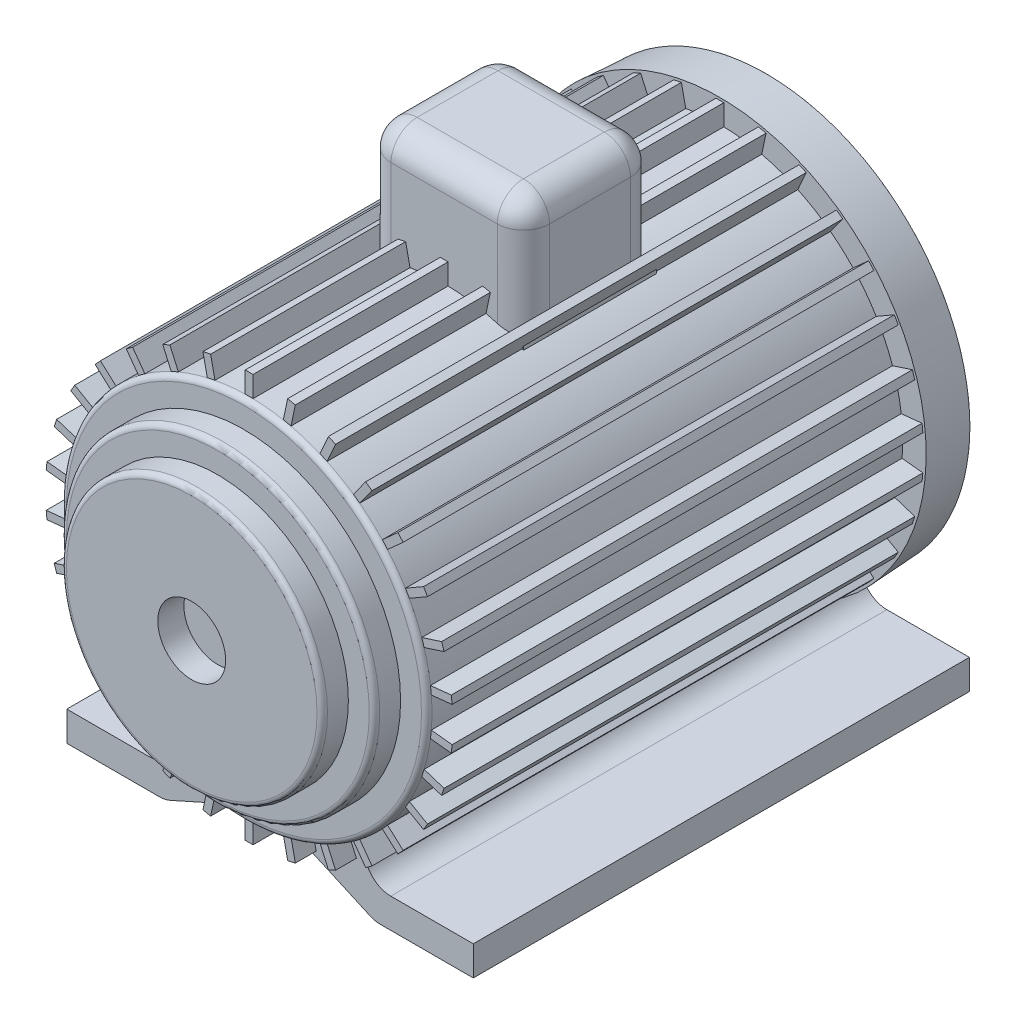
from build123d import *

# Parameters (mm, degrees)
SKETCH1_R           = 70
BOSS_EXTRUDE2_DEPTH = 200
SKETCH2_R           = 60
BOSS_EXTRUDE3_DEPTH = 10
SKETCH3_R           = 50
BOSS_EXTRUDE4_DEPTH = 10
FILLET1_R           = 2
SKETCH4_R           = 13
CUT_EXTRUDE1_DEPTH  = 10
BOSS_EXTRUDE5_DEPTH = 190
FILLET2_R           = 10
BOSS_EXTRUDE6_DEPTH = 1.5
CIRPATTERN1_COUNT   = 30
SKETCH7_W           = 60.710279946
SKETCH7_H           = 50.96617688
BOSS_EXTRUDE7_DEPTH = 110
FILLET3_R           = 10
FILLET4_R           = 10


with BuildPart() as part:
    # Sketch1 → Boss-Extrude2 (new body)
    with BuildSketch(Plane.XY):
        Circle(SKETCH1_R)
    extrude(amount=BOSS_EXTRUDE2_DEPTH)

    # Sketch2 → Boss-Extrude3 (add)
    with BuildSketch(Plane.XY.offset(200)):
        Circle(SKETCH2_R)
    extrude(amount=BOSS_EXTRUDE3_DEPTH)

    # Sketch3 → Boss-Extrude4 (add)
    with BuildSketch(Plane.XY.offset(210)):
        Circle(SKETCH3_R)
    extrude(amount=BOSS_EXTRUDE4_DEPTH)

    # Fillet1
    fillet1_edges = [part.edges().sort_by_distance(p)[0] for p in [
        (-50, 0, 220),
        (-70, 0, 200),
        (-60, 0, 210),
    ]]
    fillet(fillet1_edges, radius=FILLET1_R)

    # Sketch4 → Cut-Extrude1 (cut)
    with BuildSketch(Plane.XY.offset(220)):
        Circle(SKETCH4_R)
    extrude(amount=-CUT_EXTRUDE1_DEPTH, mode=Mode.SUBTRACT)

    # Sketch5 → Boss-Extrude5 (add)
    with BuildSketch(Plane(origin=(0, 0, 0), x_dir=(-1, 0, 0), z_dir=(0, 0, -1))):
        with BuildLine():
            ThreePointArc((0, -70), (-16.73934364, -67.969069248), (-32.507360201, -61.994124986))
            Line((-32.507360201, -61.994124986), (-40.191661565, -76.648699711))
            Line((-40.191661565, -76.648699711), (-77.839251962, -76.648699711))
            Line((-77.839251962, -76.648699711), (-77.839251962, -87.998419038))
            Line((-77.839251962, -87.998419038), (-40.191661565, -87.998419038))
            Line((-40.191661565, -87.998419038), (0, -70))
        make_face()
        with BuildLine():
            ThreePointArc((32.507360201, -61.994124986), (16.73934364, -67.969069248), (0, -70))
            Line((0, -70), (40.191661565, -87.998419038))
            Line((40.191661565, -87.998419038), (77.839251962, -87.998419038))
            Line((77.839251962, -87.998419038), (77.839251962, -76.648699711))
            Line((77.839251962, -76.648699711), (40.191661565, -76.648699711))
            Line((40.191661565, -76.648699711), (32.507360201, -61.994124986))
        make_face()
    extrude(amount=-BOSS_EXTRUDE5_DEPTH)

    # Fillet2
    fillet2_edges = [part.edges().sort_by_distance(p)[0] for p in [
        (40.191661565, -87.998419038, 95),
        (40.191661565, -76.648699711, 95),
        (32.507360201, -61.994124986, 95),
        (0, -70, 95),
        (-40.191661565, -87.998419038, 95),
        (-32.507360201, -61.994124986, 95),
        (-40.191661565, -76.648699711, 95),
    ]]
    fillet(fillet2_edges, radius=FILLET2_R)

    # Sketch6 → Boss-Extrude6 (add, symmetric)
    with BuildSketch(Plane(origin=(0, 0, 0), x_dir=(0, 0, -1), z_dir=(1, 0, 0))):
        Polygon((-198, 70), (-198, 78), (0, 78), (0, 70), (0, 66.154834394), (-198, 66.154834394), align=None)
    boss_extrude6 = extrude(amount=BOSS_EXTRUDE6_DEPTH, both=True)

    # CirPattern1: Boss-Extrude6 ×30 about axis
    cirpattern1_axis = Axis((0, 0, 0), (0, 0, 1))
    for i in range(1, CIRPATTERN1_COUNT):
        add(boss_extrude6.rotate(cirpattern1_axis, i * 360 / CIRPATTERN1_COUNT))

    # Sketch7 → Boss-Extrude7 (add)
    with BuildSketch(Plane(origin=(0, 0, 0), x_dir=(1, 0, 0), z_dir=(0, 1, 0))):
        with Locations((0, -97.820582731)):
            Rectangle(SKETCH7_W, SKETCH7_H)
    extrude(amount=BOSS_EXTRUDE7_DEPTH)

    # Fillet3
    fillet3_edges = [part.edges().sort_by_distance(p)[0] for p in [
        (-30.355139973, 110, 97.820582731),
        (0, 110, 123.303671171),
        (30.355139973, 110, 97.820582731),
        (0, 110, 72.337494291),
    ]]
    fillet(fillet3_edges, radius=FILLET3_R)

    # Fillet4
    # the kernel refuses this fillet: 10 mm, written as the material it takes off along each edge
    with BuildSketch(Plane(origin=(20.355139973, 100, 113.303671171), x_dir=(0, 0, 1), z_dir=(1, 0, 0))) as fillet4_piece_1_section:
        Polygon((0, 0), (FILLET4_R * 1.02, 0), (FILLET4_R * 1.02, -FILLET4_R * 1.02), (0, -FILLET4_R * 1.02), align=None)
    fillet4_piece_1 = extrude(amount=FILLET4_R * 1.02, mode=Mode.PRIVATE)
    fillet4_piece_1 = fillet4_piece_1 - Plane(origin=(20.355139973, 100, 113.303671171), x_dir=(0, -0.7071067811865475, -0.7071067811865475), z_dir=(1, 0, 0)) * Sphere(FILLET4_R, mode=Mode.PRIVATE)
    add(fillet4_piece_1, mode=Mode.SUBTRACT)
    with BuildSketch(Plane(origin=(-20.355139973, 100, 113.303671171), x_dir=(-1, 0, 0), z_dir=(0, 0, 1))) as fillet4_piece_2_section:
        Polygon((0, 0), (FILLET4_R * 1.02, 0), (FILLET4_R * 1.02, -FILLET4_R * 1.02), (0, -FILLET4_R * 1.02), align=None)
    fillet4_piece_2 = extrude(amount=FILLET4_R * 1.02, mode=Mode.PRIVATE)
    fillet4_piece_2 = fillet4_piece_2 - Plane(origin=(-20.355139973, 100, 113.303671171), x_dir=(0.7071067811865475, -0.7071067811865475, 0), z_dir=(0, 0, 1)) * Sphere(FILLET4_R, mode=Mode.PRIVATE)
    add(fillet4_piece_2, mode=Mode.SUBTRACT)
    with BuildSketch(Plane(origin=(-20.355139973, 100, 82.337494291), x_dir=(-1, 0, 0), z_dir=(0, 0, -1))) as fillet4_piece_3_section:
        Polygon((0, 0), (FILLET4_R * 1.02, 0), (FILLET4_R * 1.02, FILLET4_R * 1.02), (0, FILLET4_R * 1.02), align=None)
    fillet4_piece_3 = extrude(amount=FILLET4_R * 1.02, mode=Mode.PRIVATE)
    fillet4_piece_3 = fillet4_piece_3 - Plane(origin=(-20.355139973, 100, 82.337494291), x_dir=(0.7071067811865475, -0.7071067811865475, 0), z_dir=(0, 0, -1)) * Sphere(FILLET4_R, mode=Mode.PRIVATE)
    add(fillet4_piece_3, mode=Mode.SUBTRACT)
    with BuildSketch(Plane(origin=(20.355139973, 100, 82.337494291), x_dir=(0, 0, -1), z_dir=(1, 0, 0))) as fillet4_piece_4_section:
        Polygon((0, 0), (FILLET4_R * 1.02, 0), (FILLET4_R * 1.02, FILLET4_R * 1.02), (0, FILLET4_R * 1.02), align=None)
    fillet4_piece_4 = extrude(amount=FILLET4_R * 1.02, mode=Mode.PRIVATE)
    fillet4_piece_4 = fillet4_piece_4 - Plane(origin=(20.355139973, 100, 82.337494291), x_dir=(0, -0.7071067811865475, 0.7071067811865475), z_dir=(1, 0, 0)) * Sphere(FILLET4_R, mode=Mode.PRIVATE)
    add(fillet4_piece_4, mode=Mode.SUBTRACT)
    with BuildSketch(Plane(origin=(30.355139973, 46.866650661, 123.303671171), x_dir=(0, 0, -1), z_dir=(0, 1, 0))) as fillet4_piece_5_section:
        with BuildLine():
            CenterArc((FILLET4_R, FILLET4_R), FILLET4_R, 180, 90)
            Line((0, FILLET4_R), (0, 0))
            Line((0, 0), (FILLET4_R, 0))
        make_face()
    fillet4_piece_5 = extrude(amount=53.133349339, mode=Mode.PRIVATE)
    fillet4_piece_5 = split(fillet4_piece_5, bisect_by=Plane(origin=(29.066991609, 68.973422063, 121.811746024), z_dir=(-0.913545457642601, 0.40673664307580015, 0)), keep=Keep.TOP, mode=Mode.PRIVATE)
    fillet4_piece_5 = fillet4_piece_5 - Plane(origin=(0, 0, 121.811746024), x_dir=(1, 0, 0), z_dir=(0, 0, -1)) * Cylinder(70, 147, mode=Mode.PRIVATE)
    add(fillet4_piece_5, mode=Mode.SUBTRACT)
    with BuildSketch(Plane(origin=(-30.355139973, 46.866650661, 123.303671171), x_dir=(1, 0, 0), z_dir=(0, 1, 0))) as fillet4_piece_6_section:
        with BuildLine():
            CenterArc((FILLET4_R, FILLET4_R), FILLET4_R, 180, 90)
            Line((0, FILLET4_R), (0, 0))
            Line((0, 0), (FILLET4_R, 0))
        make_face()
    fillet4_piece_6 = extrude(amount=53.133349339, mode=Mode.PRIVATE)
    fillet4_piece_6 = split(fillet4_piece_6, bisect_by=Plane(origin=(-29.06699152, 68.973421864, 121.811745681), z_dir=(0.913545457642601, 0.40673664307580026, 0)), keep=Keep.TOP, mode=Mode.PRIVATE)
    fillet4_piece_6 = fillet4_piece_6 - Plane(origin=(0, 0, 121.811745681), x_dir=(1, 0, 0), z_dir=(0, 0, -1)) * Cylinder(70, 147, mode=Mode.PRIVATE)
    add(fillet4_piece_6, mode=Mode.SUBTRACT)
    with BuildSketch(Plane(origin=(-30.355139973, 46.866650661, 72.337494291), x_dir=(1, 0, 0), z_dir=(0, 1, 0))) as fillet4_piece_7_section:
        with BuildLine():
            CenterArc((FILLET4_R, -FILLET4_R), FILLET4_R, 90, 90)
            Line((0, -FILLET4_R), (0, 0))
            Line((0, 0), (FILLET4_R, 0))
        make_face()
    fillet4_piece_7 = extrude(amount=53.133349339, mode=Mode.PRIVATE)
    fillet4_piece_7 = split(fillet4_piece_7, bisect_by=Plane(origin=(-29.066991519, 68.973421861, 73.829419783), z_dir=(0.913545457642601, 0.40673664307580026, 0)), keep=Keep.TOP, mode=Mode.PRIVATE)
    fillet4_piece_7 = fillet4_piece_7 - Plane(origin=(0, 0, 73.829419783), x_dir=(1, 0, 0), z_dir=(0, 0, -1)) * Cylinder(70, 147, mode=Mode.PRIVATE)
    add(fillet4_piece_7, mode=Mode.SUBTRACT)
    with BuildSketch(Plane(origin=(30.355139973, 46.866650661, 72.337494291), x_dir=(0, 0, 1), z_dir=(0, 1, 0))) as fillet4_piece_8_section:
        with BuildLine():
            CenterArc((FILLET4_R, -FILLET4_R), FILLET4_R, 90, 90)
            Line((0, -FILLET4_R), (0, 0))
            Line((0, 0), (FILLET4_R, 0))
        make_face()
    fillet4_piece_8 = extrude(amount=53.133349339, mode=Mode.PRIVATE)
    fillet4_piece_8 = split(fillet4_piece_8, bisect_by=Plane(origin=(29.066991608, 68.973422063, 73.829419438), z_dir=(-0.913545457642601, 0.40673664307580015, 0)), keep=Keep.TOP, mode=Mode.PRIVATE)
    fillet4_piece_8 = fillet4_piece_8 - Plane(origin=(0, 0, 73.829419438), x_dir=(1, 0, 0), z_dir=(0, 0, -1)) * Cylinder(70, 147, mode=Mode.PRIVATE)
    add(fillet4_piece_8, mode=Mode.SUBTRACT)

    # Sketch8 → Revolve3 (revolve)
    with BuildSketch(Plane(origin=(0, 0, 0), x_dir=(0, 0, -1), z_dir=(1, 0, 0)), mode=Mode.PRIVATE) as revolve3_sk:
        Polygon((-17.709492379, 78.99575091), (-17.709492379, 0), (0, 0), (3.436309274, 0), (3.436309274, 69.545756172), (0, 78), align=None)
    revolve(revolve3_sk.sketch.rotate(Axis((0, 0, 17.709492379), (0, 0, -1)), 90), axis=Axis((0, 0, 17.709492379), (0, 0, -1)))


solid = part.part
